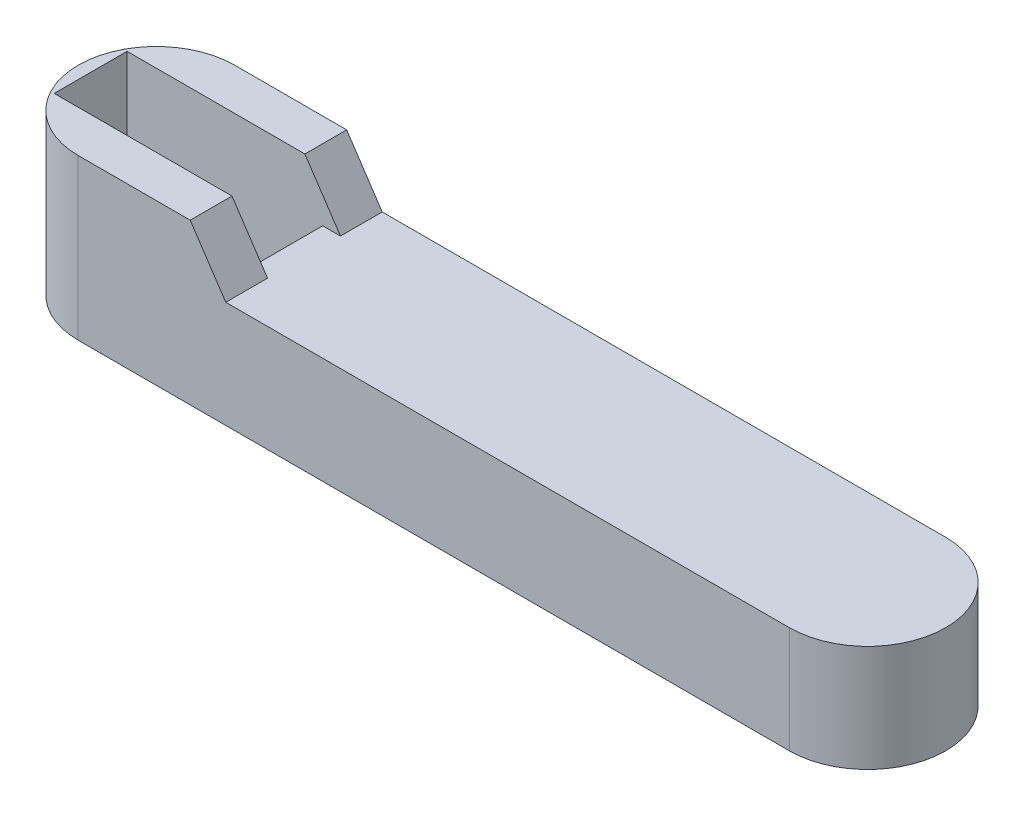
from build123d import *

# Parameters (mm, degrees)
BOSS_EXTRUDE1_DEPTH = 30
SKETCH2_R           = 7
CUT_EXTRUDE1_DEPTH  = 229.298050802
CUT_EXTRUDE2_DEPTH  = 28.5
BOSS_EXTRUDE2_DEPTH = 15
CUT_EXTRUDE3_DEPTH  = 231.748781145


with BuildPart() as part:
    # Sketch1 → Boss-Extrude1 (new body)
    with BuildSketch(Plane(origin=(0, 0, 0), x_dir=(1, 0, 0), z_dir=(0, 1, 0))):
        with BuildLine():
            Line((0, 0), (200, 0))
            ThreePointArc((200, 0), (222, 22), (200, 44))
            Line((200, 44), (0, 44))
            ThreePointArc((0, 44), (-22, 22), (0, 0))
        make_face()
    extrude(amount=BOSS_EXTRUDE1_DEPTH)

    # Sketch2 → Cut-Extrude1 (cut, through all)
    with BuildSketch(Plane(origin=(0, 30, 0), x_dir=(1, 0, 0), z_dir=(0, 1, 0))):
        with Locations((0, 22)):
            Circle(SKETCH2_R)
    extrude(amount=-CUT_EXTRUDE1_DEPTH, mode=Mode.SUBTRACT)

    # Sketch3 → Cut-Extrude2 (cut)
    with BuildSketch(Plane(origin=(0, 30, 0), x_dir=(1, 0, 0), z_dir=(0, 1, 0))):
        Polygon((0, 32.25), (-18.5, 32.25), (-18.5, 11.75), (0, 11.75), (36.5, 11.75), (36.5, 32.25), align=None)
    extrude(amount=-CUT_EXTRUDE2_DEPTH, mode=Mode.SUBTRACT)

    # Sketch5 → Boss-Extrude2 (add)
    with BuildSketch(Plane(origin=(0, 30, 0), x_dir=(1, 0, 0), z_dir=(0, 1, 0))):
        with BuildLine():
            Line((-18.5, 32.25), (-18.5, 11.75))
            Line((-18.5, 11.75), (41.5, 11.75))
            Line((41.5, 11.75), (41.5, 0))
            Line((41.5, 0), (0, 0))
            ThreePointArc((0, 0), (-22, 22), (0, 44))
            Line((0, 44), (41.5, 44))
            Line((41.5, 44), (41.5, 32.25))
            Line((41.5, 32.25), (-18.5, 32.25))
        make_face()
    extrude(amount=BOSS_EXTRUDE2_DEPTH)

    # Sketch6 → Cut-Extrude3 (cut, through all)
    with BuildSketch(Plane.XY):
        Polygon((31.5, 45), (41.5, 45), (41.5, 30), align=None)
    extrude(amount=-CUT_EXTRUDE3_DEPTH, mode=Mode.SUBTRACT)


solid = part.part
